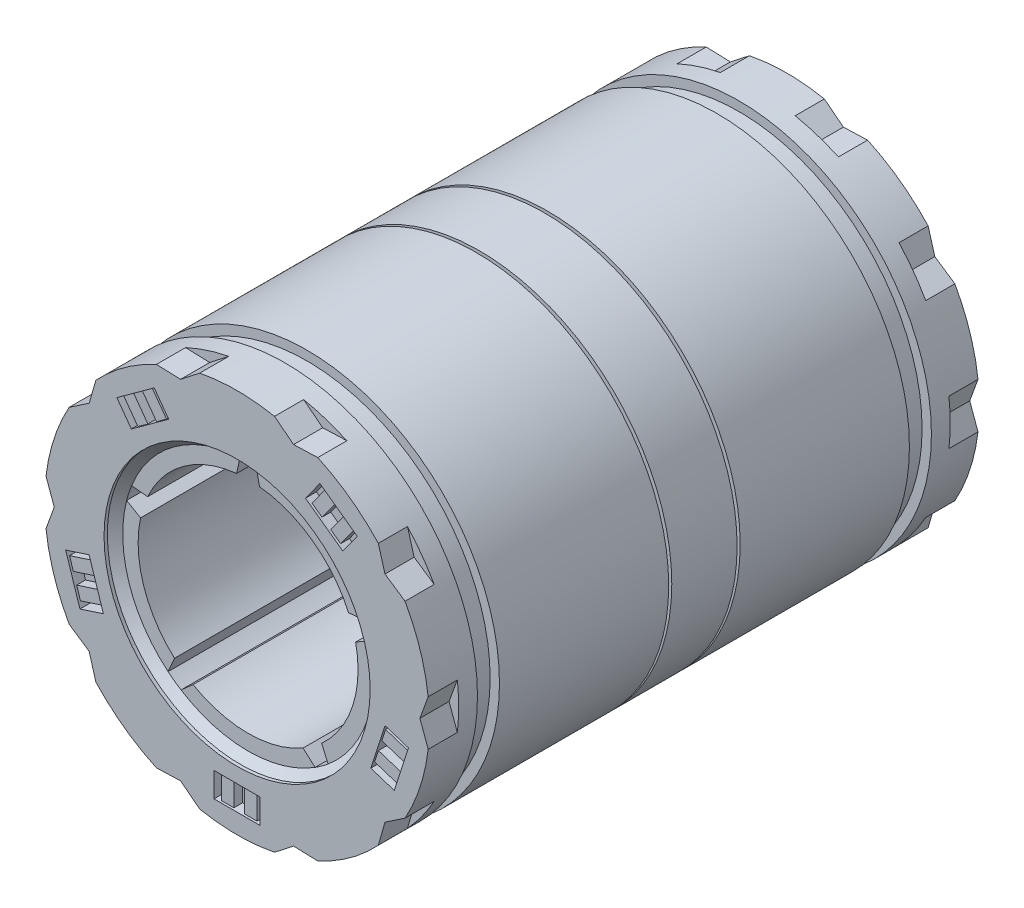
from build123d import *

# Parameters (mm, degrees)
CUT_EXTRUDE1_DEPTH      = 23.338105056
CUT_EXTRUDE1_DEPTH_BACK = 23.338105056
CUT_EXTRUDE2_START      = 15.875
SKETCH5_R               = 7.6835
CUT_EXTRUDE2_DEPTH      = 0.635
CUT_EXTRUDE3_START      = -15.24
SKETCH5_2_R             = 7.6835
CUT_EXTRUDE3_DEPTH      = 0.635
CHAMFER1_SIZE           = 0.4445
CUT_EXTRUDE5_START      = 14.19225
CUT_EXTRUDE5_DEPTH      = 1.68275
CUT_EXTRUDE6_START      = -15.875
CUT_EXTRUDE6_DEPTH      = 1.68275
CUT_EXTRUDE7_START      = 15.875
SKETCH9_W               = 0.31115
SKETCH9_H               = 1.4224
SKETCH9_W_2             = 0.6223
CUT_EXTRUDE7_DEPTH      = 0.635
CUT_EXTRUDE8_START      = 15.875
SKETCH10_W              = 2.667
SKETCH10_H              = 1.4224
CUT_EXTRUDE8_DEPTH      = 0.127
CUT_EXTRUDE9_START      = -15.875
SKETCH9_2_W             = 0.31115
SKETCH9_2_H             = 1.4224
SKETCH9_2_W_2           = 0.6223
CUT_EXTRUDE9_DEPTH      = 0.635
CUT_EXTRUDE11_START     = -15.875
SKETCH10_2_W            = 2.667
SKETCH10_2_H            = 1.4224
CUT_EXTRUDE11_DEPTH     = 0.127
CIRPATTERN2_COUNT       = 5


with BuildPart() as part:
    # Sketch3 → Revolve1 (revolve)
    with BuildSketch(Plane(origin=(0, 0, 0), x_dir=(0, 0, -1), z_dir=(1, 0, 0)), mode=Mode.PRIVATE) as revolve1_sk:
        Polygon((-15.875, 6.35), (-15.875, 11.1125), (-13.1064, 11.1125), (-13.1064, 10.57402), (-11.8364, 10.57402), (-11.8364, 11.1125), (-2.06375, 11.1125), (-2.06375, 10.668), (-1.88595, 10.668), (-1.88595, 11.1125), (1.88595, 11.1125), (1.88595, 10.668), (2.06375, 10.668), (2.06375, 11.1125), (11.8364, 11.1125), (11.8364, 10.57402), (13.1064, 10.57402), (13.1064, 11.1125), (15.875, 11.1125), (15.875, 6.35), align=None)
    revolve(revolve1_sk.sketch.rotate(Axis((0, 0, 15.875), (0, 0, -1)), 90), axis=Axis((0, 0, 15.875), (0, 0, -1)))

    # Sketch4 → Cut-Extrude1 (cut, two sides: drawn at the far end of the back side and taken through both)
    with BuildSketch(Plane.XY.offset(-CUT_EXTRUDE1_DEPTH_BACK)):
        with BuildLine():
            Line((-3.175, -5.499261314), (-3.872340554, -6.11621612))
            ThreePointArc((-3.872340554, -6.11621612), (-4.254977441, -5.856474022), (-4.620248157, -5.57282944))
            Line((-4.620248157, -5.57282944), (-4.24897935, -4.718969642))
            ThreePointArc((-4.24897935, -4.718969642), (-3.732436352, -5.137257914), (-3.175, -5.499261314))
        make_face()
        with BuildLine():
            Line((-6.211237265, 1.320239237), (-7.013486236, 1.792799995))
            ThreePointArc((-7.013486236, 1.792799995), (-6.884698121, 2.236974022), (-6.727810952, 2.672018113))
            Line((-6.727810952, 2.672018113), (-5.801013656, 2.582777684))
            ThreePointArc((-5.801013656, 2.582777684), (-6.039208878, 1.962257914), (-6.211237265, 1.320239237))
        make_face()
        with BuildLine():
            Line((3.175, -5.499261314), (3.872340554, -6.11621612))
            ThreePointArc((3.872340554, -6.11621612), (4.254977441, -5.856474022), (4.620248157, -5.57282944))
            Line((4.620248157, -5.57282944), (4.24897935, -4.718969642))
            ThreePointArc((4.24897935, -4.718969642), (3.732436352, -5.137257914), (3.175, -5.499261314))
        make_face()
        with BuildLine():
            Line((-0.663755742, 6.315214036), (-0.462232319, 7.224227452))
            ThreePointArc((-0.462232319, 7.224227452), (0, 7.239), (0.462232319, 7.224227452))
            Line((0.462232319, 7.224227452), (0.663755742, 6.315214036))
            ThreePointArc((0.663755742, 6.315214036), (0, 6.35), (-0.663755742, 6.315214036))
        make_face()
        with BuildLine():
            Line((5.801013656, 2.582777684), (6.727810952, 2.672018113))
            ThreePointArc((6.727810952, 2.672018113), (6.884698121, 2.236974022), (7.013486236, 1.792799995))
            Line((7.013486236, 1.792799995), (6.211237265, 1.320239237))
            ThreePointArc((6.211237265, 1.320239237), (6.039208878, 1.962257914), (5.801013656, 2.582777684))
        make_face()
    extrude(amount=CUT_EXTRUDE1_DEPTH + CUT_EXTRUDE1_DEPTH_BACK, mode=Mode.SUBTRACT)

    # Sketch5 → Cut-Extrude2 (cut)
    with BuildSketch(Plane.XY.offset(CUT_EXTRUDE2_START)):
        with Locations(Location((0, 0, 0), (0, 0, 180))):
            Circle(SKETCH5_R)
    extrude(amount=-CUT_EXTRUDE2_DEPTH, mode=Mode.SUBTRACT)

    # Sketch5<2> → Cut-Extrude3 (cut)
    with BuildSketch(Plane.XY.offset(CUT_EXTRUDE3_START)):
        with Locations(Location((0, 0, 0), (0, 0, 180))):
            Circle(SKETCH5_2_R)
    extrude(amount=-CUT_EXTRUDE3_DEPTH, mode=Mode.SUBTRACT)

    # Chamfer1
    chamfer1_edges = [part.edges().sort_by_distance(p)[0] for p in [
        (7.6835, 0, 15.24),
        (7.6835, 0, -15.24),
    ]]
    chamfer(chamfer1_edges, length=CHAMFER1_SIZE - 0.0001)  # a hair under: the kernel refuses the full size

    # Sketch8 → Cut-Extrude5 (cut)
    with BuildSketch(Plane.XY.offset(CUT_EXTRUDE5_START)):
        with BuildLine():
            Line((-4.658426971, 10.088940203), (-3.262253782, 10.04018476))
            Line((-3.262253782, 10.04018476), (-2.161383676, 10.900278751))
            ThreePointArc((-2.161383676, 10.900278751), (-3.43395135, 10.568615537), (-4.658426971, 10.088940203))
        make_face()
        with BuildLine():
            Line((2.161383676, 10.900278751), (3.262253782, 10.04018476))
            Line((3.262253782, 10.04018476), (4.658426971, 10.088940203))
            ThreePointArc((4.658426971, 10.088940203), (3.43395135, 10.568615537), (2.161383676, 10.900278751))
        make_face()
        with BuildLine():
            Line((8.155619221, 7.548081304), (8.540691282, 6.205175435))
            Line((8.540691282, 6.205175435), (9.698876849, 5.423969407))
            ThreePointArc((9.698876849, 5.423969407), (8.99020135, 6.531763616), (8.155619221, 7.548081304))
        make_face()
        with BuildLine():
            Line((11.034685423, 1.312773348), (10.556875, 0))
            Line((10.556875, 0), (11.034685423, -1.312773348))
            ThreePointArc((11.034685423, -1.312773348), (11.1125, 0), (11.034685423, 1.312773348))
        make_face()
        with BuildLine():
            Line((9.698876849, -5.423969407), (8.540691282, -6.205175435))
            Line((8.540691282, -6.205175435), (8.155619221, -7.548081304))
            ThreePointArc((8.155619221, -7.548081304), (8.99020135, -6.531763616), (9.698876849, -5.423969407))
        make_face()
        with BuildLine():
            Line((4.658426971, -10.088940203), (3.262253782, -10.04018476))
            Line((3.262253782, -10.04018476), (2.161383676, -10.900278751))
            ThreePointArc((2.161383676, -10.900278751), (3.43395135, -10.568615537), (4.658426971, -10.088940203))
        make_face()
        with BuildLine():
            Line((-2.161383676, -10.900278751), (-3.262253782, -10.04018476))
            Line((-3.262253782, -10.04018476), (-4.658426971, -10.088940203))
            ThreePointArc((-4.658426971, -10.088940203), (-3.43395135, -10.568615537), (-2.161383676, -10.900278751))
        make_face()
        with BuildLine():
            Line((-8.155619221, -7.548081304), (-8.540691282, -6.205175435))
            Line((-8.540691282, -6.205175435), (-9.698876849, -5.423969407))
            ThreePointArc((-9.698876849, -5.423969407), (-8.99020135, -6.531763616), (-8.155619221, -7.548081304))
        make_face()
        with BuildLine():
            Line((-11.034685423, -1.312773348), (-10.556875, 0))
            Line((-10.556875, 0), (-11.034685423, 1.312773348))
            ThreePointArc((-11.034685423, 1.312773348), (-11.1125, 0), (-11.034685423, -1.312773348))
        make_face()
        with BuildLine():
            Line((-9.698876849, 5.423969407), (-8.540691282, 6.205175435))
            Line((-8.540691282, 6.205175435), (-8.155619221, 7.548081304))
            ThreePointArc((-8.155619221, 7.548081304), (-8.99020135, 6.531763616), (-9.698876849, 5.423969407))
        make_face()
    extrude(amount=CUT_EXTRUDE5_DEPTH, mode=Mode.SUBTRACT)

    # Sketch8<2> → Cut-Extrude6 (cut)
    with BuildSketch(Plane.XY.offset(CUT_EXTRUDE6_START)):
        with BuildLine():
            Line((-4.658426971, 10.088940203), (-3.262253782, 10.04018476))
            Line((-3.262253782, 10.04018476), (-2.161383676, 10.900278751))
            ThreePointArc((-2.161383676, 10.900278751), (-3.43395135, 10.568615537), (-4.658426971, 10.088940203))
        make_face()
        with BuildLine():
            Line((2.161383676, 10.900278751), (3.262253782, 10.04018476))
            Line((3.262253782, 10.04018476), (4.658426971, 10.088940203))
            ThreePointArc((4.658426971, 10.088940203), (3.43395135, 10.568615537), (2.161383676, 10.900278751))
        make_face()
        with BuildLine():
            Line((8.155619221, 7.548081304), (8.540691282, 6.205175435))
            Line((8.540691282, 6.205175435), (9.698876849, 5.423969407))
            ThreePointArc((9.698876849, 5.423969407), (8.99020135, 6.531763616), (8.155619221, 7.548081304))
        make_face()
        with BuildLine():
            Line((11.034685423, 1.312773348), (10.556875, 0))
            Line((10.556875, 0), (11.034685423, -1.312773348))
            ThreePointArc((11.034685423, -1.312773348), (11.1125, 0), (11.034685423, 1.312773348))
        make_face()
        with BuildLine():
            Line((9.698876849, -5.423969407), (8.540691282, -6.205175435))
            Line((8.540691282, -6.205175435), (8.155619221, -7.548081304))
            ThreePointArc((8.155619221, -7.548081304), (8.99020135, -6.531763616), (9.698876849, -5.423969407))
        make_face()
        with BuildLine():
            Line((4.658426971, -10.088940203), (3.262253782, -10.04018476))
            Line((3.262253782, -10.04018476), (2.161383676, -10.900278751))
            ThreePointArc((2.161383676, -10.900278751), (3.43395135, -10.568615537), (4.658426971, -10.088940203))
        make_face()
        with BuildLine():
            Line((-2.161383676, -10.900278751), (-3.262253782, -10.04018476))
            Line((-3.262253782, -10.04018476), (-4.658426971, -10.088940203))
            ThreePointArc((-4.658426971, -10.088940203), (-3.43395135, -10.568615537), (-2.161383676, -10.900278751))
        make_face()
        with BuildLine():
            Line((-8.155619221, -7.548081304), (-8.540691282, -6.205175435))
            Line((-8.540691282, -6.205175435), (-9.698876849, -5.423969407))
            ThreePointArc((-9.698876849, -5.423969407), (-8.99020135, -6.531763616), (-8.155619221, -7.548081304))
        make_face()
        with BuildLine():
            Line((-11.034685423, -1.312773348), (-10.556875, 0))
            Line((-10.556875, 0), (-11.034685423, 1.312773348))
            ThreePointArc((-11.034685423, 1.312773348), (-11.1125, 0), (-11.034685423, -1.312773348))
        make_face()
        with BuildLine():
            Line((-9.698876849, 5.423969407), (-8.540691282, 6.205175435))
            Line((-8.540691282, 6.205175435), (-8.155619221, 7.548081304))
            ThreePointArc((-8.155619221, 7.548081304), (-8.99020135, 6.531763616), (-9.698876849, 5.423969407))
        make_face()
    extrude(amount=CUT_EXTRUDE6_DEPTH, mode=Mode.SUBTRACT)

    # Sketch9 → Cut-Extrude7 (cut)
    with BuildSketch(Plane.XY.offset(CUT_EXTRUDE7_START)):
        with Locations((-1.177925, -9.26338)):
            Rectangle(SKETCH9_W, SKETCH9_H)
        with Locations((1.177925, -9.26338)):
            Rectangle(SKETCH9_W, SKETCH9_H)
        with Locations((0, -9.26338)):
            Rectangle(SKETCH9_W_2, SKETCH9_H)
    cut_extrude7 = extrude(amount=-CUT_EXTRUDE7_DEPTH, mode=Mode.SUBTRACT)

    # Sketch10 → Cut-Extrude8 (cut)
    with BuildSketch(Plane.XY.offset(CUT_EXTRUDE8_START)):
        with Locations((0, -9.26338)):
            Rectangle(SKETCH10_W, SKETCH10_H)
    cut_extrude8 = extrude(amount=-CUT_EXTRUDE8_DEPTH, mode=Mode.SUBTRACT)

    # Sketch9<2> → Cut-Extrude9 (cut)
    with BuildSketch(Plane.XY.offset(CUT_EXTRUDE9_START)):
        with Locations((-1.177925, -9.26338)):
            Rectangle(SKETCH9_2_W, SKETCH9_2_H)
        with Locations((1.177925, -9.26338)):
            Rectangle(SKETCH9_2_W, SKETCH9_2_H)
        with Locations((0, -9.26338)):
            Rectangle(SKETCH9_2_W_2, SKETCH9_2_H)
    cut_extrude9 = extrude(amount=CUT_EXTRUDE9_DEPTH, mode=Mode.SUBTRACT)

    # Sketch10<2> → Cut-Extrude11 (cut)
    with BuildSketch(Plane.XY.offset(CUT_EXTRUDE11_START)):
        with Locations((0, -9.26338)):
            Rectangle(SKETCH10_2_W, SKETCH10_2_H)
    cut_extrude11 = extrude(amount=CUT_EXTRUDE11_DEPTH, mode=Mode.SUBTRACT)

    # CirPattern2: Cut-Extrude7, Cut-Extrude8, Cut-Extrude9, Cut-Extrude11 ×5 about axis
    cirpattern2_axis = Axis((0, 0, 0), (0, 0, 1))
    add([cut_extrude7.rotate(cirpattern2_axis, i * 360 / CIRPATTERN2_COUNT) for i in range(1, CIRPATTERN2_COUNT)], mode=Mode.SUBTRACT)
    add([cut_extrude8.rotate(cirpattern2_axis, i * 360 / CIRPATTERN2_COUNT) for i in range(1, CIRPATTERN2_COUNT)], mode=Mode.SUBTRACT)
    add([cut_extrude9.rotate(cirpattern2_axis, i * 360 / CIRPATTERN2_COUNT) for i in range(1, CIRPATTERN2_COUNT)], mode=Mode.SUBTRACT)
    add([cut_extrude11.rotate(cirpattern2_axis, i * 360 / CIRPATTERN2_COUNT) for i in range(1, CIRPATTERN2_COUNT)], mode=Mode.SUBTRACT)


solid = part.part
